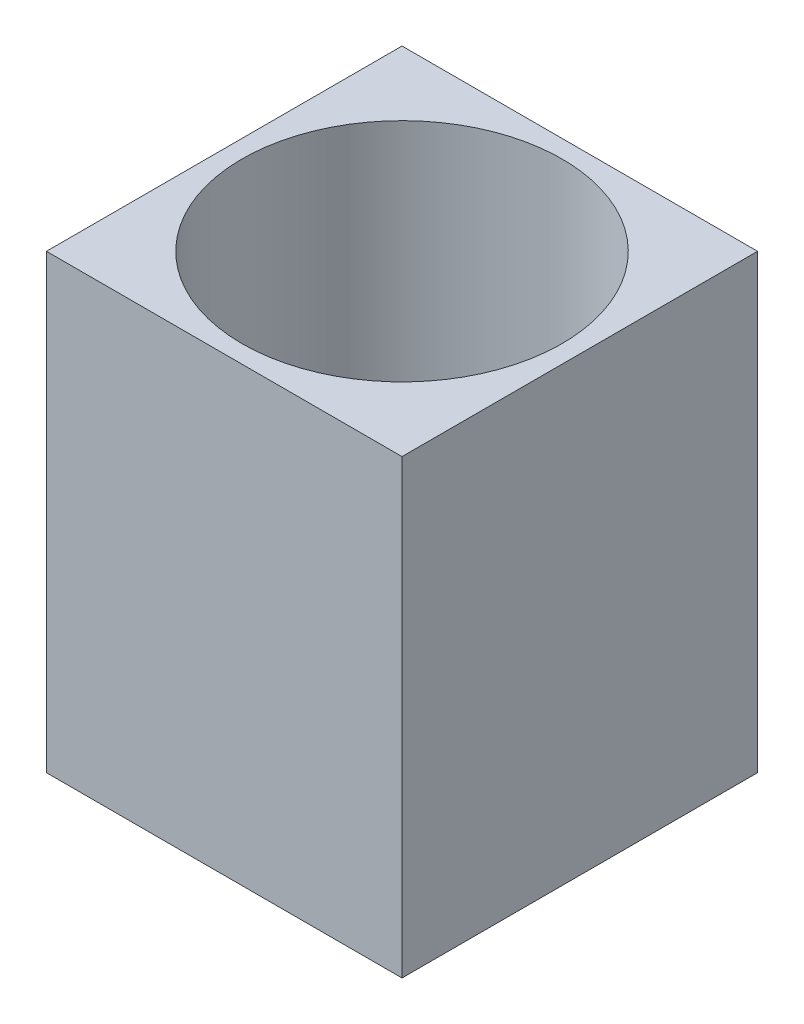
from build123d import *

# Parameters (mm, degrees)
SKETCH1_W           = 10
SKETCH1_H           = 10
SKETCH1_R           = 4.5
BOSS_EXTRUDE1_DEPTH = 12.7


with BuildPart() as part:
    # Sketch1 → Boss-Extrude1 (new body)
    with BuildSketch(Plane(origin=(0, 0, 0), x_dir=(1, 0, 0), z_dir=(0, 1, 0))):
        with Locations((5, -5)):
            Rectangle(SKETCH1_W, SKETCH1_H)
        with Locations((5, -5)):
            Circle(SKETCH1_R, mode=Mode.SUBTRACT)
    extrude(amount=BOSS_EXTRUDE1_DEPTH)


solid = part.part
